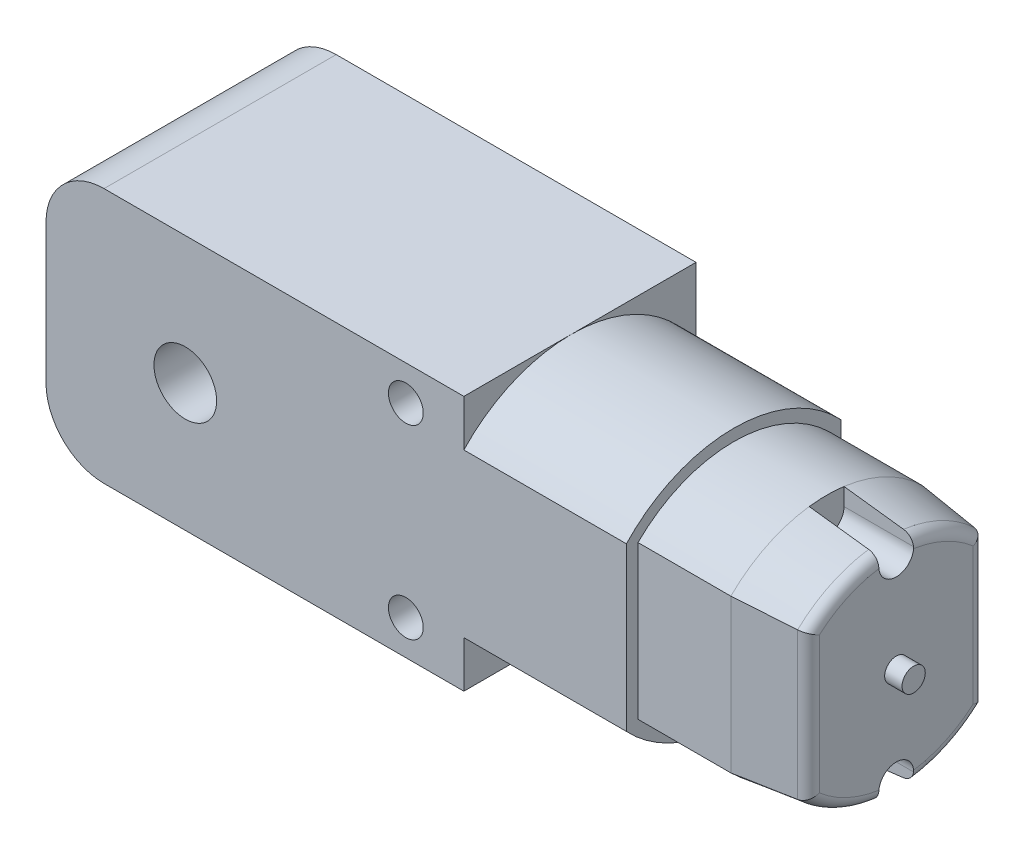
from build123d import *

# Parameters (mm, degrees)
CROQUIS1_W               = 50
CROQUIS1_H               = 20
SALIENTE_EXTRUIR1_DEPTH  = 11
REDONDEO1_R              = 5
CROQUIS2_OUTSIDE_W       = 33.634
CROQUIS2_OUTSIDE_H       = 35.634
CORTAR_EXTRUIR1_DEPTH    = 14
CROQUIS3_R               = 1.5
CORTAR_EXTRUIR2_DEPTH    = 34.85262176
SALIENTE_EXTRUIR6_DEPTH  = 8
CROQUIS9_R               = 2.7
CORTAR_EXTRUIR5_DEPTH    = 41.124805295
SALIENTE_EXTRUIR7_DEPTH  = 6
SALIENTE_EXTRUIR7_DRAFT  = 7
REDONDEO2_R              = 1
CORTAR_EXTRUIR6_START    = -6
CORTAR_EXTRUIR6_DEPTH    = 6
CROQUIS15_W              = 2
CROQUIS15_H              = 5
SALIENTE_EXTRUIR10_DEPTH = 5.5
CROQUIS16_R              = 1.5
CORTAR_EXTRUIR7_DEPTH    = 42.988093643
CROQUIS17_R              = 1
SALIENTE_EXTRUIR11_DEPTH = 1.5
CORTAR_EXTRUIR8_START    = -5.5
CROQUIS18_W              = 2
CROQUIS18_H              = 5
CORTAR_EXTRUIR8_DEPTH    = 79.039644333


with BuildPart() as part:
    # Croquis1 → Saliente-Extruir1 (new, symmetric)
    with BuildSketch(Plane(origin=(0, 0, 0), x_dir=(1, 0, 0), z_dir=(0, 1, 0))):
        Rectangle(CROQUIS1_W, CROQUIS1_H)
    extrude(amount=SALIENTE_EXTRUIR1_DEPTH, both=True)

    # Redondeo1
    redondeo1_edges = [part.edges().sort_by_distance(p)[0] for p in [
        (-25, 11, 0),
        (-25, -11, 0),
    ]]
    fillet(redondeo1_edges, radius=REDONDEO1_R)

    # Croquis2 outside → Cortar-Extruir1 (cut)
    with BuildSketch(Plane(origin=(25, 0, 0), x_dir=(0, 0, -1), z_dir=(1, 0, 0))):
        Rectangle(CROQUIS2_OUTSIDE_W, CROQUIS2_OUTSIDE_H)
        with BuildLine():
            Line((-10, 7), (-10, -7))
            ThreePointArc((-10, -7), (-0.75, -11), (8.5, -7))
            Line((8.5, -7), (8.5, 7))
            ThreePointArc((8.5, 7), (-0.75, 11), (-10, 7))
        make_face(mode=Mode.SUBTRACT)
    extrude(amount=-CORTAR_EXTRUIR1_DEPTH, mode=Mode.SUBTRACT)

    # Croquis3 → Cortar-Extruir2 (cut, through all)
    with BuildSketch(Plane(origin=(0, 0, -10), x_dir=(-1, 0, 0), z_dir=(0, 0, -1))):
        with Locations((-6, 8)):
            Circle(CROQUIS3_R)
        with Locations(Location((-6, -8, 0), (0, 0, 180))):
            Circle(CROQUIS3_R)
    extrude(amount=-CORTAR_EXTRUIR2_DEPTH, mode=Mode.SUBTRACT)

    # Croquis8 → Saliente-Extruir6 (add)
    with BuildSketch(Plane(origin=(25, 0, 0), x_dir=(0, 0, -1), z_dir=(1, 0, 0))):
        with BuildLine():
            Line((-9, 6.594309595), (-9, -6.594309595))
            ThreePointArc((-9, -6.594309595), (-0.75, -10), (7.5, -6.594309595))
            Line((7.5, -6.594309595), (7.5, 6.594309595))
            ThreePointArc((7.5, 6.594309595), (-0.75, 10), (-9, 6.594309595))
        make_face()
    extrude(amount=SALIENTE_EXTRUIR6_DEPTH)

    # Croquis9 → Cortar-Extruir5 (cut, through all)
    with BuildSketch(Plane.XY.offset(10)):
        with Locations((-13, 0)):
            Circle(CROQUIS9_R)
    extrude(amount=-CORTAR_EXTRUIR5_DEPTH, mode=Mode.SUBTRACT)


with BuildPart() as saliente_extruir7_tool:
    # Croquis11 → Saliente-Extruir7 (with draft: the straight prism first)
    with BuildSketch(Plane(origin=(33, 0, 0), x_dir=(0, 0, -1), z_dir=(1, 0, 0))):
        with BuildLine():
            Line((-9, 6.594309595), (-9, -6.594309595))
            ThreePointArc((-9, -6.594309595), (-0.75, -10), (7.5, -6.594309595))
            Line((7.5, -6.594309595), (7.5, 6.594309595))
            ThreePointArc((7.5, 6.594309595), (-0.75, 10), (-9, 6.594309595))
        make_face()
    extrude(amount=SALIENTE_EXTRUIR7_DEPTH)
    # Saliente-Extruir7: the draft: its side faces are tilted about the plane it starts from
    saliente_extruir7_sides = [saliente_extruir7_tool.faces().sort_by_distance(p)[0] for p in [
        (36, 0, 9),
        (36, -10, 0.75),
        (36, 0, -7.5),
        (36, 10, 0.75),
    ]]
    draft(saliente_extruir7_sides, Plane(origin=(33, 0, 0), x_dir=(0, 0, -1), z_dir=(1, 0, 0)), SALIENTE_EXTRUIR7_DRAFT)


with BuildPart() as part_1:
    add(part.part)

    # Saliente-Extruir7: add saliente_extruir7_tool
    add(saliente_extruir7_tool.part)

    # Redondeo2
    redondeo2_edges = [part_1.edges().sort_by_distance(p)[0] for p in [
        (39, 0, -6.763292635),
        (39, -9.263292635, 0.75),
        (39, 0, 8.263292635),
        (39, 9.263292635, 0.75),
    ]]
    fillet(redondeo2_edges, radius=REDONDEO2_R - 0.0001)  # a hair under: the kernel refuses the full size

    # Croquis14 → Cortar-Extruir6 (cut)
    with BuildSketch(Plane(origin=(39, 0, 0), x_dir=(0, 0, -1), z_dir=(1, 0, 0)).offset(CORTAR_EXTRUIR6_START)):
        with BuildLine():
            Line((-2.25, 9.903408743), (-2.25, 8.403408743))
            ThreePointArc((-2.25, 8.403408743), (-0.75, 6.903408743), (0.75, 8.403408743))
            Line((0.75, 8.403408743), (0.75, 9.903408743))
            ThreePointArc((0.75, 9.903408743), (-0.75, 10), (-2.25, 9.903408743))
        make_face()
        with BuildLine():
            Line((-2.25, -9.903408743), (-2.25, -8.403408743))
            ThreePointArc((-2.25, -8.403408743), (-0.75, -6.903408743), (0.75, -8.403408743))
            Line((0.75, -8.403408743), (0.75, -9.903408743))
            ThreePointArc((0.75, -9.903408743), (-0.75, -10), (-2.25, -9.903408743))
        make_face()
    extrude(amount=CORTAR_EXTRUIR6_DEPTH, mode=Mode.SUBTRACT)

    # Croquis15 → Saliente-Extruir10 (add)
    with BuildSketch(Plane.ZY.offset(25)):
        Rectangle(CROQUIS15_W, CROQUIS15_H)
    extrude(amount=SALIENTE_EXTRUIR10_DEPTH)

    # Croquis16 → Cortar-Extruir7 (cut, through all)
    with BuildSketch(Plane.XY.offset(1)):
        with Locations((-27.75, 0)):
            Circle(CROQUIS16_R)
    extrude(amount=-CORTAR_EXTRUIR7_DEPTH, mode=Mode.SUBTRACT)

    # Croquis17 → Saliente-Extruir11 (add)
    with BuildSketch(Plane(origin=(39, 0, 0), x_dir=(0, 0, -1), z_dir=(1, 0, 0))):
        with Locations((-0.75, 0)):
            Circle(CROQUIS17_R)
    extrude(amount=SALIENTE_EXTRUIR11_DEPTH)

    # Croquis18 → Cortar-Extruir8 (cut, through all)
    with BuildSketch(Plane.ZY.offset(30.5).offset(CORTAR_EXTRUIR8_START)):
        Rectangle(CROQUIS18_W, CROQUIS18_H)
    extrude(amount=CORTAR_EXTRUIR8_DEPTH, mode=Mode.SUBTRACT)


solid = part_1.part
